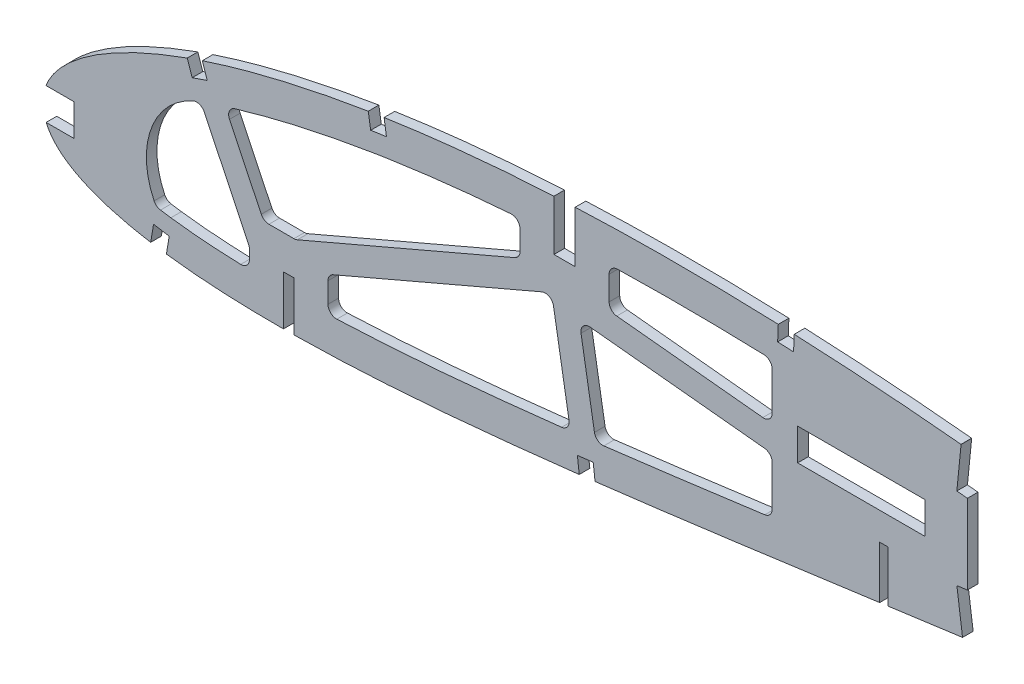
from build123d import *

# Parameters (mm, degrees)
BOSS_EXTRUDE1_DEPTH = 3.175
CUT_EXTRUDE1_DEPTH  = 7.62
SKETCH3_R           = 6.35
CUT_EXTRUDE2_DEPTH  = 7.62
SKETCH4_W           = 38.1
SKETCH4_H           = 9.525
SKETCH4_R           = 6.35
CUT_EXTRUDE3_DEPTH  = 443.627115857
CUT_EXTRUDE4_START  = -3.175
CUT_EXTRUDE4_DEPTH  = 3.175
FILLET1_R           = 2.54


# Read off the part's stored shape, not the designer's step: Cut-Extrude4
with BuildPart() as part:
    # Sketch1 → Boss-Extrude1 (new body)
    with BuildSketch(Plane.XY):
        with BuildLine():
            Line((435.33010469, 0.678691456), (439.172882547, -1.614212492))
            Line((439.172882547, -1.614212492), (434.787151486, -0.678691456))
            add(Edge.make_bspline(
                [(0, 0), (0.11179123, -0.527729161), (0.335887463, -1.58561283), (0.94472768, -3.108527015), (1.749889805, -4.572488672), (2.768272335, -5.973609192), (3.993104005, -7.311505618), (5.421679636, -8.587569541), (7.052598221, -9.801114861), (8.883725224, -10.951589231), (10.912400596, -12.040213999), (13.136344152, -13.066312264), (15.553528081, -14.029563428), (18.161318821, -14.928679795), (20.956528242, -15.765030781), (23.936498821, -16.536578215), (27.097842034, -17.244400464), (30.437517266, -17.886690773), (33.951885298, -18.464101669), (37.637295209, -18.976309975), (41.489964184, -19.423636044), (45.506112459, -19.80514129), (49.681767661, -20.121646285), (54.012767863, -20.373360955), (58.494909036, -20.561083494), (63.123897762, -20.684100336), (67.895200479, -20.744329207), (72.804505265, -20.742674403), (77.847009648, -20.678693244), (83.018406129, -20.555920262), (88.313732191, -20.373577887), (93.728207214, -20.133872554), (99.256947275, -19.839216685), (104.89499369, -19.49060908), (110.637384794, -19.089594814), (116.479134607, -18.639389777), (122.414936441, -18.141116951), (128.439613477, -17.597680601), (134.547832047, -17.011801372), (140.734314746, -16.385333349), (146.993600903, -15.721223571), (153.320115485, -15.021624036), (159.708476563, -14.290267097), (166.152848405, -13.528475979), (172.647781594, -12.740600204), (179.187166024, -11.928145018), (185.765533466, -11.094239816), (192.376967293, -10.242811017), (199.015278084, -9.37376151), (205.674882543, -8.493282903), (212.349358377, -7.600650086), (219.032895906, -6.7004538), (225.719308248, -5.795492203), (232.402082768, -4.886043807), (239.075345122, -3.975877517), (245.732904616, -3.06749205), (252.368240069, -2.160970285), (258.975348295, -1.26081803), (265.547576185, -0.366925322), (272.078863439, 0.518895586), (278.562951189, 1.394000598), (284.993721977, 2.257285217), (291.364542133, 3.108203268), (297.66900214, 3.947074317), (303.806375969, 4.748436439), (309.760626579, 5.554962658), (315.551818652, 6.216135275), (321.27090305, 6.780469964), (326.923820465, 7.243146515), (332.503782957, 7.610821489), (338.004397185, 7.886122043), (343.419107553, 8.072891719), (348.74107448, 8.176671364), (353.963650696, 8.200094537), (359.079707468, 8.150631139), (364.082590991, 8.032268225), (368.965318868, 7.850318702), (373.721079318, 7.610921079), (378.343117125, 7.320601554), (382.824493294, 6.983642622), (387.158963185, 6.607910686), (391.339839301, 6.198906082), (395.360701925, 5.761301701), (399.215684034, 5.304267166), (402.898615263, 4.830811549), (406.403955911, 4.348715399), (409.726063296, 3.862864382), (412.859676284, 3.379461168), (415.799871302, 2.903117573), (418.541899149, 2.440155772), (421.081464376, 1.994901374), (423.414160264, 1.571702591), (425.536750687, 1.175899009), (427.445043551, 0.809456817), (429.136486586, 0.478415007), (430.607934716, 0.184234372), (431.857230885, -0.068940506), (432.88219343, -0.280110359), (433.681265576, -0.445808771), (434.252869013, -0.566300363), (434.596385478, -0.637999126), (434.749014267, -0.670556399), (434.787151486, -0.678691456)],
                knots=[0, 0, 0, 0, 0.003638255, 0.007293231, 0.011028136, 0.014901081, 0.018963272, 0.023258475, 0.027820626, 0.032679082, 0.03785316, 0.043361875, 0.049214679, 0.055422346, 0.061988786, 0.068918036, 0.076211157, 0.083868392, 0.091887411, 0.100265912, 0.108999867, 0.118084529, 0.127514843, 0.13728527, 0.147387917, 0.157816481, 0.168563473, 0.179619128, 0.190977373, 0.202626974, 0.214560478, 0.226767249, 0.239236417, 0.251959004, 0.264923894, 0.278119703, 0.291536035, 0.30516028, 0.318980685, 0.332985499, 0.34716279, 0.361498603, 0.375980747, 0.390597192, 0.405332593, 0.420174823, 0.435109533, 0.450124276, 0.465203068, 0.480333154, 0.495500583, 0.510689775, 0.525887334, 0.541078314, 0.556247233, 0.571381785, 0.58646604, 0.601484515, 0.616424329, 0.631269423, 0.646006524, 0.660620684, 0.675098187, 0.689422858, 0.703581825, 0.716907563, 0.730009274, 0.742952128, 0.755725557, 0.768319951, 0.780724337, 0.792926528, 0.804916041, 0.816679084, 0.828203525, 0.8394749, 0.850481359, 0.861207697, 0.871639326, 0.881763414, 0.891563605, 0.901027365, 0.910138977, 0.918883977, 0.927249278, 0.935221104, 0.942784739, 0.949928188, 0.956638465, 0.962904203, 0.968712288, 0.974054485, 0.978918432, 0.983297219, 0.987180246, 0.990560674, 0.993433357, 0.995790626, 0.997629588, 0.998945816, 0.999736592, 1, 1, 1, 1], degree=3))
            add(Edge.make_bspline(
                [(435.33010469, 0.678691456), (435.296755582, 0.699293055), (435.163488681, 0.781619431), (434.863214309, 0.965803828), (434.363194901, 1.272571896), (433.663211466, 1.69979322), (432.763807452, 2.246333125), (431.664530435, 2.908364558), (430.366066728, 3.683736897), (428.86873043, 4.568782589), (427.172675107, 5.559358025), (425.278546429, 6.651449737), (423.186509465, 7.838875427), (420.897374442, 9.116782681), (418.411926851, 10.4790944), (415.730636684, 11.919657082), (412.854464224, 13.43114364), (409.784513475, 15.00705265), (406.521344218, 16.638681918), (403.066494801, 18.319240705), (399.421116368, 20.040349747), (395.586453278, 21.79282696), (391.56470833, 23.569527811), (387.356993489, 25.359407096), (382.965706604, 27.15470981), (378.392717175, 28.945218407), (373.640732922, 30.722778715), (368.711587102, 32.475875028), (363.608964359, 34.196846251), (358.335340013, 35.87451254), (352.894485425, 37.499762392), (347.289561815, 39.062058655), (341.52524157, 40.553388886), (335.605180365, 41.962892679), (329.534395845, 43.28113527), (323.317713598, 44.500180123), (316.960347344, 45.607856696), (310.479914041, 46.603301327), (303.980682286, 47.431342852), (297.494822244, 48.243461645), (291.0186212, 49.006373108), (284.46326746, 49.736966294), (277.835067652, 50.431127833), (271.140596349, 51.086687253), (264.386630807, 51.700815013), (257.580189535, 52.27171033), (250.727858804, 52.796138155), (243.836864005, 53.273290553), (236.914017847, 53.698972807), (229.966694004, 54.072865307), (223.001944897, 54.392360355), (216.027018499, 54.655256617), (209.049321182, 54.859966995), (202.076096041, 55.004530305), (195.114893299, 55.088037667), (188.172953688, 55.108207309), (181.257823923, 55.064678381), (174.376745271, 54.95595632), (167.537272154, 54.780552763), (160.7466557, 54.538140281), (154.012238926, 54.228824112), (147.341395315, 53.850013849), (140.741361553, 53.404123644), (134.219487317, 52.889280335), (127.782938298, 52.305347044), (121.438460058, 51.65475786), (115.193116172, 50.935743156), (109.053599754, 50.150348891), (103.026626206, 49.300114834), (97.118957953, 48.384577869), (91.33692342, 47.406382542), (85.686763085, 46.366529581), (80.174454785, 45.268067638), (74.805999973, 44.111283189), (69.587081438, 42.899646299), (64.52312301, 41.635267927), (59.619568317, 40.320462769), (54.881388132, 38.958385816), (50.313373811, 37.552127128), (45.920850559, 36.103231966), (41.707138151, 34.617193881), (37.677412709, 33.095067788), (33.834761135, 31.541542875), (30.183686712, 29.958740393), (26.726916941, 28.351485511), (23.468364091, 26.721608068), (20.41035055, 25.073674406), (17.555946308, 23.410211446), (14.907899047, 21.73430892), (12.467321746, 20.050217809), (10.237579271, 18.35899521), (8.219437586, 16.664914738), (6.414173801, 14.97055608), (4.824368385, 13.277086383), (3.449964137, 11.587487839), (2.292762263, 9.903098559), (1.352963468, 8.225512409), (0.632693499, 6.555947979), (0.13123808, 4.895344207), (-0.143255259, 3.246152095), (-0.211578297, 1.607049514), (-0.07042072, 0.534882766), (0, 0)],
                knots=[0, 0, 0, 0, 0.00025409, 0.001015373, 0.002283359, 0.004056577, 0.006330982, 0.009105274, 0.012374489, 0.016134023, 0.02037966, 0.025105976, 0.030306237, 0.035972206, 0.042099522, 0.048678064, 0.055701664, 0.063160184, 0.071045824, 0.079349826, 0.08806291, 0.097175756, 0.106678112, 0.116561573, 0.126814275, 0.137428301, 0.148393618, 0.15969976, 0.171338126, 0.183297699, 0.195569604, 0.208143556, 0.221011593, 0.234161831, 0.24758745, 0.261276822, 0.27522271, 0.289414144, 0.303771199, 0.317689227, 0.331784111, 0.346039677, 0.36044387, 0.37498272, 0.389640454, 0.404403316, 0.419256601, 0.434186749, 0.449177265, 0.464214782, 0.479284009, 0.49436974, 0.509457833, 0.524532346, 0.53957932, 0.554582984, 0.569529546, 0.584403417, 0.599190992, 0.613876838, 0.628447475, 0.642888675, 0.657186054, 0.671325546, 0.685294014, 0.699078147, 0.712665095, 0.726042645, 0.739197713, 0.752117586, 0.764792042, 0.777208152, 0.789355685, 0.80122396, 0.812803686, 0.824082909, 0.835054602, 0.845709571, 0.856037853, 0.866033834, 0.875688843, 0.884997719, 0.893953426, 0.902552897, 0.910789386, 0.918660734, 0.926166253, 0.933302626, 0.94007122, 0.94647478, 0.952517526, 0.958204819, 0.963546652, 0.9685566, 0.973249913, 0.977651041, 0.981787043, 0.985694226, 0.989415109, 0.993001157, 0.996508416, 1, 1, 1, 1], degree=3))
        make_face()
    extrude(amount=BOSS_EXTRUDE1_DEPTH)

    # Sketch2 → Cut-Extrude1 (cut)
    with BuildSketch(Plane(origin=(0, 0, 0), x_dir=(-1, 0, 0), z_dir=(0, 0, -1))):
        Polygon((-252.794440989, 13.221493744), (-250.254440989, 13.221493744), (-250.254440989, -2.115243028), (-250.254440989, -3.986349358), (-252.794440989, -3.050796193), (-252.794440989, -2.115243028), align=None)
        Polygon((-159.131940989, 54.422217902), (-159.131940989, 39.039100326), (-152.781940989, 39.039100326), (-152.781940989, 54.422217902), (-152.781940989, 57.645440557), (-159.131940989, 55.540936844), align=None)
        Polygon((-74.994440989, -5.928775484), (-74.994440989, -20.141805429), (-74.994440989, -20.97642061), (-71.819440989, -22.145862066), (-71.819440989, -20.141805429), (-71.819440989, -5.928775484), align=None)
    extrude(amount=-CUT_EXTRUDE1_DEPTH, mode=Mode.SUBTRACT)

    # Sketch3 → Cut-Extrude2 (cut)
    with BuildSketch(Plane(origin=(0, 0, 0), x_dir=(-1, 0, 0), z_dir=(0, 0, -1))):
        with Locations((-292.383806588, 26.255421435)):
            Circle(SKETCH3_R)
    extrude(amount=-CUT_EXTRUDE2_DEPTH, mode=Mode.SUBTRACT)

    # Sketch4 → Cut-Extrude3 (cut, through all)
    # profile 1 of 12: a face of its own
    with BuildSketch(Plane.XY.offset(3.175)):
        with BuildLine():
            Line((9.08354865, 6.810338827), (0.76430461, 6.810338827))
            add(Edge.make_bspline(
                [(0.76430461, 6.810338827), (0.726676763, 6.71299191), (0.488212559, 6.077489506), (0.13123808, 4.895344207), (-0.143255259, 3.246152095), (-0.211578297, 1.607049514), (-0.07042072, 0.534882766), (0, 0)],
                knots=[0.98501809, 0.98501809, 0.98501809, 0.98501809, 0.985694226, 0.989415109, 0.993001157, 0.996508416, 1, 1, 1, 1], degree=3))
            add(Edge.make_bspline(
                [(0, 0), (0.11179123, -0.527729161), (0.307969583, -1.453821818), (0.640979835, -2.341032636), (0.803006074, -2.714661173)],
                knots=[0, 0, 0, 0, 0.003638255, 0.006384641, 0.006384641, 0.006384641, 0.006384641], degree=3))
            Line((0.803006074, -2.714661173), (9.08354865, -2.714661173))
            Line((9.08354865, -2.714661173), (9.08354865, 6.810338827))
        make_face()
    # profile 2 of 12: a face of its own
    with BuildSketch(Plane.XY.offset(3.175)):
        with BuildLine():
            Line((49.020517996, 32.253888691), (47.531675541, 36.629642878))
            add(Edge.make_bspline(
                [(47.531675541, 36.629642878), (46.979087567, 36.445759538), (45.474608141, 35.938686183), (43.975608762, 35.415532918), (43.028960398, 35.077347923)],
                knots=[0.862258912, 0.862258912, 0.862258912, 0.862258912, 0.866033834, 0.872549698, 0.872549698, 0.872549698, 0.872549698], degree=3))
            Line((43.028960398, 35.077347923), (44.512019179, 30.71972624))
            Line((44.512019179, 30.71972624), (49.020517996, 32.253888691))
        make_face()
    # profile 3 of 12: a face of its own
    with BuildSketch(Plane.XY.offset(3.175)):
        Polygon((36.838817299, -18.581245887), (32.165910286, -17.731153874), (32.952371753, -13.02357497), (37.641753761, -13.808241987), align=None)
    # profile 4 of 12: a face of its own
    with BuildSketch(Plane.XY.offset(3.175)):
        with BuildLine():
            Line((102.645386654, 44.510393866), (101.9478561, 49.125267329))
            add(Edge.make_bspline(
                [(101.9478561, 49.125267329), (100.365650198, 48.887111331), (98.784740474, 48.64033843), (97.205261705, 48.38471328)],
                knots=[0.741480352, 0.741480352, 0.741480352, 0.741480352, 0.751851659, 0.751851659, 0.751851659, 0.751851659], degree=3))
            Line((97.205261705, 48.38471328), (97.936400792, 43.798607145))
            Line((97.936400792, 43.798607145), (102.645386654, 44.510393866))
        make_face()
    # profile 5 of 12: a face of its own
    with BuildSketch(Plane.XY.offset(3.175)):
        with BuildLine():
            add(Edge.make_bspline(
                [(160.340338786, -14.212647666), (161.920044437, -14.028275741), (163.499504121, -13.841797301), (165.078745983, -13.653492366)],
                knots=[0.377458898, 0.377458898, 0.377458898, 0.377458898, 0.388202054, 0.388202054, 0.388202054, 0.388202054], degree=3))
            Line((165.078745983, -13.653492366), (164.522590598, -8.953423812))
            Line((164.522590598, -8.953423812), (159.793087001, -9.513059826))
            Line((159.793087001, -9.513059826), (160.340338786, -14.212647666))
        make_face()
    # profile 6 of 12: a face of its own
    with BuildSketch(Plane.XY.offset(3.175)):
        with BuildLine():
            Line((224.483551568, 49.643099482), (224.695252101, 54.310425843))
            add(Edge.make_bspline(
                [(224.695252101, 54.310425843), (224.131555977, 54.335094277), (222.536497131, 54.403324951), (220.941251233, 54.467084737), (219.909719875, 54.506423891)],
                knots=[0.475626644, 0.475626644, 0.475626644, 0.475626644, 0.479284009, 0.485975235, 0.485975235, 0.485975235, 0.485975235], degree=3))
            Line((219.909719875, 54.506423891), (219.725798523, 49.849814949))
            Line((219.725798523, 49.849814949), (224.483551568, 49.643099482))
        make_face()
    # profile 7 of 12: a face of its own
    with BuildSketch(Plane.XY.offset(3.175)):
        with Locations((244.758806588, 26.255421435)):
            Rectangle(SKETCH4_W, SKETCH4_H)
    # profile 8 of 12: a face of its own
    with BuildSketch(Plane.XY.offset(3.175)):
        Polygon((276.508806588, 37.713859181), (277.787367709, 50.342830172), (274.606587067, 50.664683683), (273.349658498, 38.028091323), align=None)
    # profile 9 of 12: a face of its own
    with BuildSketch(Plane.XY.offset(3.175)):
        with BuildLine():
            Line((274.606587067, 50.745349283), (274.606587067, 50.664683683))
            Line((274.606587067, 50.664683683), (277.787367709, 50.342830172))
            Line((277.787367709, 50.342830172), (276.508806588, 37.713859181))
            Line((276.508806588, 37.713859181), (276.508806588, 13.934637567))
            Line((276.508806588, 13.934637567), (278.202158297, 1.347675194))
            Line((278.202158297, 1.347675194), (275.057635426, 0.924468904))
            Line((275.057635426, 0.924468904), (275.057635426, 0.920727129))
            add(Edge.make_bspline(
                [(275.057635426, 0.920727129), (276.232091103, 1.079260303), (279.550679689, 1.526596029), (284.993721977, 2.257285217), (291.364542133, 3.108203268), (297.66900214, 3.947074317), (303.806375969, 4.748436439), (309.760626579, 5.554962658), (315.551818652, 6.216135275), (321.27090305, 6.780469964), (326.923820465, 7.243146515), (332.503782957, 7.610821489), (338.004397185, 7.886122043), (343.419107553, 8.072891719), (348.74107448, 8.176671364), (353.963650696, 8.200094537), (359.079707468, 8.150631139), (364.082590991, 8.032268225), (368.965318868, 7.850318702), (373.721079318, 7.610921079), (378.343117125, 7.320601554), (382.824493294, 6.983642622), (387.158963185, 6.607910686), (391.339839301, 6.198906082), (395.360701925, 5.761301701), (399.215684034, 5.304267166), (402.898615263, 4.830811549), (406.403955911, 4.348715399), (409.726063296, 3.862864382), (412.859676284, 3.379461168), (415.799871302, 2.903117573), (418.541899149, 2.440155772), (421.081464376, 1.994901374), (423.414160264, 1.571702591), (425.536750687, 1.175899009), (427.445043551, 0.809456817), (429.136486586, 0.478415007), (430.607934716, 0.184234372), (431.857230885, -0.068940506), (432.88219343, -0.280110359), (433.681265576, -0.445808771), (434.252869013, -0.566300363), (434.596385478, -0.637999126), (434.749014267, -0.670556399), (434.787151486, -0.678691456)],
                knots=[0.638001263, 0.638001263, 0.638001263, 0.638001263, 0.646006524, 0.660620684, 0.675098187, 0.689422858, 0.703581825, 0.716907563, 0.730009274, 0.742952128, 0.755725557, 0.768319951, 0.780724337, 0.792926528, 0.804916041, 0.816679084, 0.828203525, 0.8394749, 0.850481359, 0.861207697, 0.871639326, 0.881763414, 0.891563605, 0.901027365, 0.910138977, 0.918883977, 0.927249278, 0.935221104, 0.942784739, 0.949928188, 0.956638465, 0.962904203, 0.968712288, 0.974054485, 0.978918432, 0.983297219, 0.987180246, 0.990560674, 0.993433357, 0.995790626, 0.997629588, 0.998945816, 0.999736592, 1, 1, 1, 1], degree=3))
            Line((434.787151486, -0.678691456), (439.172882547, -1.614212492))
            Line((439.172882547, -1.614212492), (435.33010469, 0.678691456))
            add(Edge.make_bspline(
                [(435.33010469, 0.678691456), (435.296755582, 0.699293055), (435.163488681, 0.781619431), (434.863214309, 0.965803828), (434.363194901, 1.272571896), (433.663211466, 1.69979322), (432.763807452, 2.246333125), (431.664530435, 2.908364558), (430.366066728, 3.683736897), (428.86873043, 4.568782589), (427.172675107, 5.559358025), (425.278546429, 6.651449737), (423.186509465, 7.838875427), (420.897374442, 9.116782681), (418.411926851, 10.4790944), (415.730636684, 11.919657082), (412.854464224, 13.43114364), (409.784513475, 15.00705265), (406.521344218, 16.638681918), (403.066494801, 18.319240705), (399.421116368, 20.040349747), (395.586453278, 21.79282696), (391.56470833, 23.569527811), (387.356993489, 25.359407096), (382.965706604, 27.15470981), (378.392717175, 28.945218407), (373.640732922, 30.722778715), (368.711587102, 32.475875028), (363.608964359, 34.196846251), (358.335340013, 35.87451254), (352.894485425, 37.499762392), (347.289561815, 39.062058655), (341.52524157, 40.553388886), (335.605180365, 41.962892679), (329.534395845, 43.28113527), (323.317713598, 44.500180123), (316.960347344, 45.607856696), (310.479914041, 46.603301327), (303.980682286, 47.431342852), (297.494822244, 48.243461645), (291.0186212, 49.006373108), (284.46326746, 49.736966294), (278.983592298, 50.31084455), (275.689561404, 50.639206846), (274.606587067, 50.745349283)],
                knots=[0, 0, 0, 0, 0.00025409, 0.001015373, 0.002283359, 0.004056577, 0.006330982, 0.009105274, 0.012374489, 0.016134023, 0.02037966, 0.025105976, 0.030306237, 0.035972206, 0.042099522, 0.048678064, 0.055701664, 0.063160184, 0.071045824, 0.079349826, 0.08806291, 0.097175756, 0.106678112, 0.116561573, 0.126814275, 0.137428301, 0.148393618, 0.15969976, 0.171338126, 0.183297699, 0.195569604, 0.208143556, 0.221011593, 0.234161831, 0.24758745, 0.261276822, 0.27522271, 0.289414144, 0.303771199, 0.317689227, 0.331784111, 0.346039677, 0.36044387, 0.367497329, 0.367497329, 0.367497329, 0.367497329], degree=3))
        make_face()
        with Locations((292.383806588, 26.255421435)):
            Circle(SKETCH4_R, mode=Mode.SUBTRACT)
    # profile 10 of 12: a face of its own
    with BuildSketch(Plane.XY.offset(3.175)):
        Polygon((273.362227422, 13.510785566), (275.057635426, 0.924468904), (278.202158297, 1.347675194), (276.508806588, 13.934637567), align=None)
    # profile 11 of 12: a face of its own
    with BuildSketch(Plane.XY.offset(3.175)):
        with BuildLine():
            add(Edge.make_bspline(
                [(32.095086313, -18.155090016), (32.696595442, -18.254411923), (34.259232792, -18.501714728), (35.825676123, -18.723786999), (36.789618427, -18.851689263)],
                knots=[0.087769382, 0.087769382, 0.087769382, 0.087769382, 0.091887411, 0.098455639, 0.098455639, 0.098455639, 0.098455639], degree=3))
            Line((32.095086313, -18.155090016), (31.569154849, -21.303195765))
            Line((31.569154849, -21.303195765), (36.202816036, -22.07730833))
            Line((36.202816036, -22.07730833), (36.789618427, -18.851689263))
        make_face()
    # profile 12 of 12: a face of its own
    with BuildSketch(Plane.XY.offset(3.175)):
        with BuildLine():
            Line((32.165910286, -17.731153874), (32.095086313, -18.155090016))
            add(Edge.make_bspline(
                [(32.095086313, -18.155090016), (32.696595442, -18.254411923), (34.259232792, -18.501714728), (35.825676123, -18.723786999), (36.789618427, -18.851689263)],
                knots=[0.087769382, 0.087769382, 0.087769382, 0.087769382, 0.091887411, 0.098455639, 0.098455639, 0.098455639, 0.098455639], degree=3))
            Line((36.789618427, -18.851689263), (36.838817299, -18.581245887))
            Line((36.838817299, -18.581245887), (32.165910286, -17.731153874))
        make_face()
    extrude(amount=-CUT_EXTRUDE3_DEPTH, mode=Mode.SUBTRACT)

    # Cut-Extrude4 outline → Cut-Extrude4 (cut)
    with BuildSketch(Plane.XY.offset(3.175).offset(CUT_EXTRUDE4_START)):
        with BuildLine():
            Line((33.750304635, -8.130826836), (38.126001981, -8.779962549))
            add(Edge.make_bspline(
                [(38.126001981, -8.779962549), (40.050911621, -9.035372337), (43.89501312, -9.472355735), (49.771384144, -9.957143864), (55.691332875, -10.291917772), (59.672337606, -10.42904626), (61.659440989, -10.478274979)],
                knots=[0.098455639, 0.098455639, 0.098455639, 0.098455639, 0.112356042, 0.126256445, 0.140156848, 0.154057251, 0.154057251, 0.154057251, 0.154057251], degree=3))
            Line((61.659440989, -10.478274979), (61.659440989, -4.576017827))
            Line((61.659440989, -4.576017827), (47.113551651, 25.739342287))
            Line((47.113551651, 25.739342287), (46.447001316, 25.509558403))
            ThreePointArc((46.447001316, 25.509558403), (32.315357449, 11.626970147), (33.750304635, -8.130826836))
        make_face()
        with BuildLine():
            Line((85.154440989, 0.085573021), (85.154440989, -10.314046037))
            add(Edge.make_bspline(
                [(85.154440989, -10.314046037), (91.30643828, -10.104541756), (103.581511382, -9.467459189), (122.0918811, -8.023956363), (140.135999894, -6.26855599), (152.029299566, -4.948481183), (157.730112002, -4.287750844)],
                knots=[0.208313152, 0.208313152, 0.208313152, 0.208313152, 0.250599588, 0.292886025, 0.335172461, 0.374190583, 0.374190583, 0.374190583, 0.374190583], degree=3))
            Line((157.730112002, -4.287750844), (152.105567066, 28.800986791))
            Line((152.105567066, 28.800986791), (85.154440989, 0.085573021))
        make_face()
        with BuildLine():
            Line((103.460118976, 39.078443901), (98.828450528, 38.355213888))
            add(Edge.make_bspline(
                [(98.828450528, 38.355213888), (94.730990044, 37.692074902), (86.544188847, 36.241191648), (74.409725368, 33.667474005), (63.675126346, 30.952051822), (57.070567325, 29.010481987), (54.398186072, 28.171784086)],
                knots=[0.751851659, 0.751851659, 0.751851659, 0.751851659, 0.779453473, 0.807055286, 0.834657099, 0.853595573, 0.853595573, 0.853595573, 0.853595573], degree=3))
            Line((54.398186072, 28.171784086), (65.885324238, 4.231224516))
            Line((65.885324238, 4.231224516), (75.488690109, 4.231224516))
            Line((75.488690109, 4.231224516), (142.621940989, 33.024751821))
            Line((142.621940989, 33.024751821), (142.621940989, 43.341052807))
            add(Edge.make_bspline(
                [(142.621940989, 43.341052807), (139.340458894, 43.107276543), (132.779290137, 42.582816537), (122.965928825, 41.619856198), (113.187018545, 40.4671029), (106.699910704, 39.566102197), (103.460118976, 39.078443901)],
                knots=[0.654625525, 0.654625525, 0.654625525, 0.654625525, 0.676339232, 0.698052939, 0.719766645, 0.741480352, 0.741480352, 0.741480352, 0.741480352], degree=3))
        make_face()
        with BuildLine():
            Line((160.317415694, 25.96221562), (165.307450284, -3.393749573))
            add(Edge.make_bspline(
                [(165.307450284, -3.393749573), (165.426757604, -3.379440535), (172.024532447, -2.587569729), (185.69552962, -0.880390909), (201.403686209, 1.184282116), (212.40147223, 2.658071414), (216.316841517, 3.185687895), (218.088806588, 3.425003992)],
                knots=[0.391464249, 0.391464249, 0.391464249, 0.391464249, 0.392279797, 0.436561634, 0.484921214, 0.499547483, 0.511637378, 0.511637378, 0.511637378, 0.511637378], degree=3))
            Line((218.088806588, 3.425003992), (218.088806588, 20.086471067))
            Line((218.088806588, 20.086471067), (160.317415694, 25.96221562))
        make_face()
        with BuildLine():
            Line((218.088806588, 27.745781367), (218.088806588, 44.407248442))
            add(Edge.make_bspline(
                [(218.088806588, 44.407248442), (217.969328739, 44.411599233), (214.258106044, 44.545942818), (206.357113765, 44.778933064), (194.390758575, 44.95703332), (181.831516652, 44.935821206), (173.471992357, 44.775789201), (169.291940989, 44.656607646)],
                knots=[0.489112922, 0.489112922, 0.489112922, 0.489112922, 0.489897344, 0.513479142, 0.540983049, 0.568486956, 0.595990863, 0.595990863, 0.595990863, 0.595990863], degree=3))
            Line((169.291940989, 44.656607646), (169.291940989, 32.708755476))
            Line((169.291940989, 32.708755476), (218.088806588, 27.745781367))
        make_face()
    extrude(amount=CUT_EXTRUDE4_DEPTH, mode=Mode.SUBTRACT)

    # Fillet1
    fillet1_edges = [part.edges().sort_by_distance(p)[0] for p in [
        (160.317415694, 25.96221562, 1.5875),
        (218.088806588, 20.086471067, 1.5875),
        (218.088806588, 3.425003992, 1.5875),
        (165.307450284, -3.393749573, 1.5875),
        (169.291940989, 32.708755476, 1.5875),
        (169.291940989, 44.656607646, 1.5875),
        (218.088806588, 44.407248442, 1.5875),
        (218.088806588, 27.745781367, 1.5875),
        (85.154440989, 0.085573021, 1.5875),
        (152.105567066, 28.800986791, 1.5875),
        (85.154440989, -10.314046037, 1.5875),
        (157.730112002, -4.287750844, 1.5875),
        (142.621940989, 33.024751821, 1.5875),
        (98.828450528, 38.355213888, 1.5875),
        (103.460118976, 39.078443901, 1.5875),
        (142.621940989, 43.341052807, 1.5875),
        (75.488690109, 4.231224516, 1.5875),
        (65.885324238, 4.231224516, 1.5875),
        (61.659440989, -10.478274979, 1.5875),
        (61.659440989, -4.576017827, 1.5875),
        (54.398186072, 28.171784086, 1.5875),
        (47.113551651, 25.739342287, 1.5875),
        (33.750304635, -8.130826836, 1.5875),
    ]]
    fillet(fillet1_edges, radius=FILLET1_R)


solid = part.part
